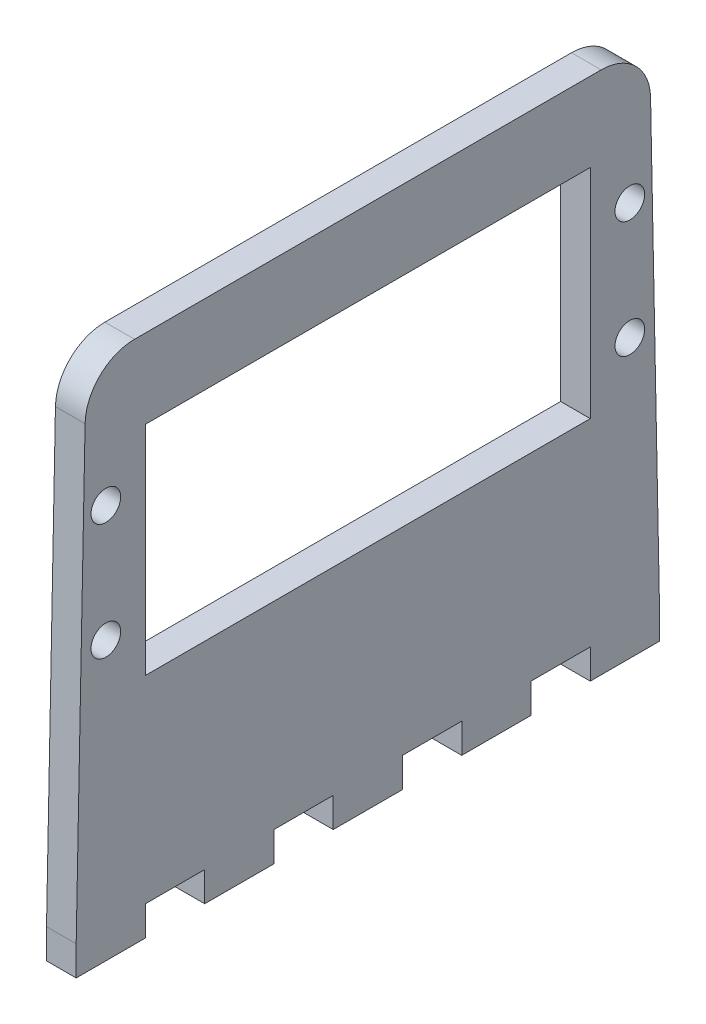
from build123d import *

# Parameters (mm, degrees)
SKETCH1_R           = 1.5
SKETCH1_W           = 45
SKETCH1_H           = 22
BOSS_EXTRUDE1_DEPTH = 3
FILLET1_R           = 5


with BuildPart() as part:
    # Sketch1 → Boss-Extrude1 (new body)
    with BuildSketch(Plane(origin=(0, 0, 0), x_dir=(0, 0, -1), z_dir=(1, 0, 0))):
        Polygon((-33, 0), (-32, 50), (25, 50), (26, 0), (26, -3), (19, -3), (19, 0), (13, 0), (13, -3), (6, -3), (6, 0), (0, 0), (0, -3), (-7, -3), (-7, 0), (-13, 0), (-13, -3), (-20, -3), (-20, 0), (-26, 0), (-26, -3), (-33, -3), align=None)
        with Locations((23, 36.9)):
            Circle(SKETCH1_R, mode=Mode.SUBTRACT)
        with Locations((23, 25.1)):
            Circle(SKETCH1_R, mode=Mode.SUBTRACT)
        with Locations((-30, 36.9)):
            Circle(SKETCH1_R, mode=Mode.SUBTRACT)
        with Locations((-30, 25.1)):
            Circle(SKETCH1_R, mode=Mode.SUBTRACT)
        with Locations((-3.5, 31)):
            Rectangle(SKETCH1_W, SKETCH1_H, mode=Mode.SUBTRACT)
    extrude(amount=BOSS_EXTRUDE1_DEPTH)

    # Fillet1
    fillet1_edges = [part.edges().sort_by_distance(p)[0] for p in [
        (1.5, 50, 32),
        (1.5, 50, -25),
    ]]
    fillet(fillet1_edges, radius=FILLET1_R)


solid = part.part
